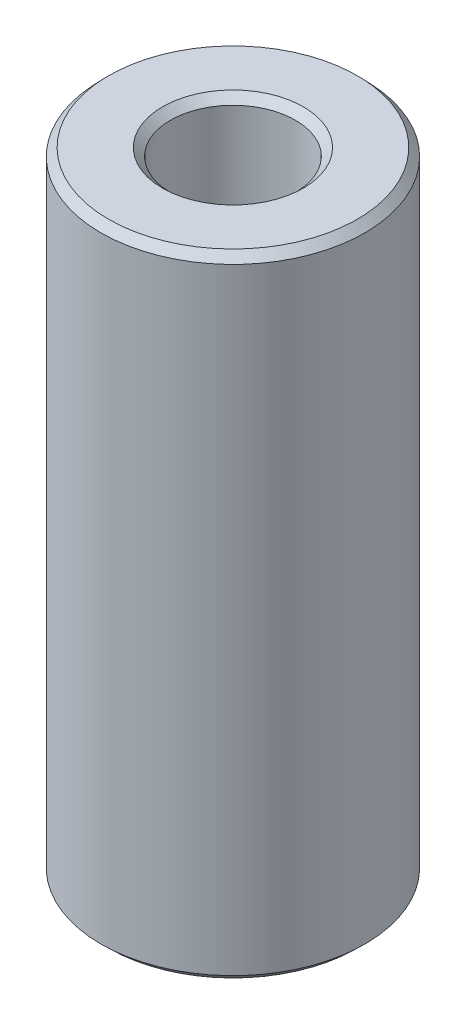
from build123d import *
from OCP.BRepFilletAPI import BRepFilletAPI_MakeChamfer

# Parameters (mm, degrees)
SKETCH1_R           = 47.5
BOSS_EXTRUDE1_DEPTH = 227.245825442
SKETCH2_R           = 22.499200899
CUT_EXTRUDE1_DEPTH  = 237.966590853
CHAMFER1_SIZE       = 2.85798881
CHAMFER1_SIZE2      = 2.749468073


with BuildPart() as part:
    # Sketch1 → Boss-Extrude1 (new body)
    with BuildSketch(Plane(origin=(0, 0, 0), x_dir=(1, 0, 0), z_dir=(0, 1, 0))):
        Circle(SKETCH1_R)
    extrude(amount=BOSS_EXTRUDE1_DEPTH)

    # Sketch2 → Cut-Extrude1 (cut, through all)
    with BuildSketch(Plane(origin=(0, 0, 0), x_dir=(1, 0, 0), z_dir=(0, 1, 0))):
        Circle(SKETCH2_R)
    extrude(amount=CUT_EXTRUDE1_DEPTH, mode=Mode.SUBTRACT)

    # Chamfer1: one chamfer whose edges measure the first distance from different faces: ONE call of the kernel's chamfer builder (chamfer() names one face for all edges)
    chamfer1_edges_1 = [part.edges().sort_by_distance(p)[0] for p in [
        (-22.499200899, 227.245825442, 0),
    ]]
    chamfer1_side_1 = [part.faces().sort_by_distance(p)[0] for p in [
        (-46.156497116, 227.245825442, 0),
    ]]
    chamfer1_edges_2 = [part.edges().sort_by_distance(p)[0] for p in [
        (-22.499200899, 0, 0),
    ]]
    chamfer1_side_2 = [part.faces().sort_by_distance(p)[0] for p in [
        (-22.499200899, 113.622912721, 0),
    ]]
    chamfer1_edges_3 = [part.edges().sort_by_distance(p)[0] for p in [
        (-47.5, 0, 0),
    ]]
    chamfer1_side_3 = [part.faces().sort_by_distance(p)[0] for p in [
        (-46.156497116, 0, 0),
    ]]
    chamfer1_edges_4 = [part.edges().sort_by_distance(p)[0] for p in [
        (-47.5, 227.245825442, 0),
    ]]
    chamfer1_side_4 = [part.faces().sort_by_distance(p)[0] for p in [
        (-47.5, 113.622912721, 0),
    ]]
    chamfer1 = BRepFilletAPI_MakeChamfer(part.part.solid().wrapped)
    for e in chamfer1_edges_1:
        chamfer1.Add(CHAMFER1_SIZE, CHAMFER1_SIZE2, e.wrapped, chamfer1_side_1[0].wrapped)  # the first distance lies on this face
    for e in chamfer1_edges_2:
        chamfer1.Add(CHAMFER1_SIZE, CHAMFER1_SIZE2, e.wrapped, chamfer1_side_2[0].wrapped)  # the first distance lies on this face
    for e in chamfer1_edges_3:
        chamfer1.Add(CHAMFER1_SIZE, CHAMFER1_SIZE2, e.wrapped, chamfer1_side_3[0].wrapped)  # the first distance lies on this face
    for e in chamfer1_edges_4:
        chamfer1.Add(CHAMFER1_SIZE, CHAMFER1_SIZE2, e.wrapped, chamfer1_side_4[0].wrapped)  # the first distance lies on this face
    add(Compound.cast(chamfer1.Shape()), mode=Mode.REPLACE)


solid = part.part
